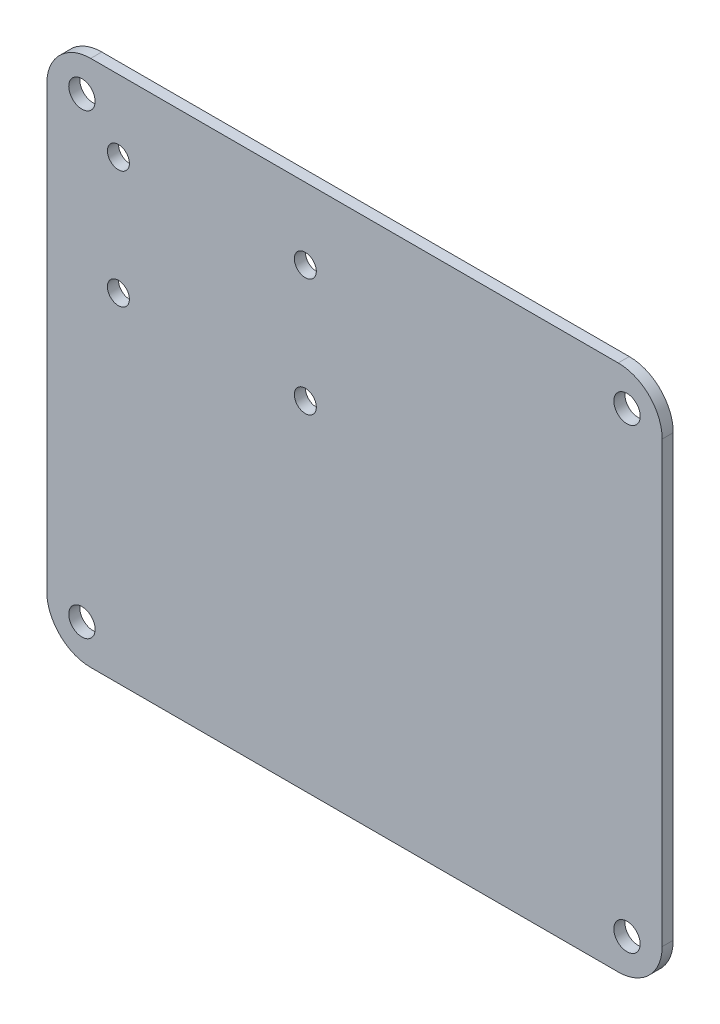
from build123d import *

# Parameters (mm, degrees)
SKETCH1_W           = 88.9
SKETCH1_H           = 76.2
BOSS_EXTRUDE1_DEPTH = 1.6
SKETCH2_R           = 1.5875
CUT_EXTRUDE1_DEPTH  = 101.188481331
SKETCH4_R           = 1.905
CUT_EXTRUDE2_DEPTH  = 101.188481331
FILLET1_R           = 6.35


with BuildPart() as part:
    # Sketch1 → Boss-Extrude1 (new body)
    with BuildSketch(Plane.XY):
        with Locations((28.959521177, 30.063142475)):
            Rectangle(SKETCH1_W, SKETCH1_H)
    extrude(amount=BOSS_EXTRUDE1_DEPTH)

    # Sketch2 → Cut-Extrude1 (cut, through all)
    with BuildSketch(Plane(origin=(0, 0, 0), x_dir=(-1, 0, 0), z_dir=(0, 0, -1))):
        with Locations((5.140478823, 57.813142475)):
            Circle(SKETCH2_R)
        with Locations((-21.859521177, 57.813142475)):
            Circle(SKETCH2_R)
        with Locations((-21.859521177, 40.813142475)):
            Circle(SKETCH2_R)
        with Locations((5.140478823, 40.813142475)):
            Circle(SKETCH2_R)
    extrude(amount=-CUT_EXTRUDE1_DEPTH, mode=Mode.SUBTRACT)

    # Sketch4 → Cut-Extrude2 (cut, through all)
    with BuildSketch(Plane(origin=(0, 0, 0), x_dir=(-1, 0, 0), z_dir=(0, 0, -1))):
        with Locations((10.410478823, 63.083142475)):
            Circle(SKETCH4_R)
        with Locations((-68.329521177, 63.083142475)):
            Circle(SKETCH4_R)
        with Locations((-68.329521177, -2.956857525)):
            Circle(SKETCH4_R)
        with Locations((10.410478823, -2.956857525)):
            Circle(SKETCH4_R)
    extrude(amount=-CUT_EXTRUDE2_DEPTH, mode=Mode.SUBTRACT)

    # Fillet1
    fillet1_edges = [part.edges().sort_by_distance(p)[0] for p in [
        (73.409521177, 68.163142475, 0.8),
        (73.409521177, -8.036857525, 0.8),
        (-15.490478823, -8.036857525, 0.8),
        (-15.490478823, 68.163142475, 0.8),
    ]]
    fillet(fillet1_edges, radius=FILLET1_R)


solid = part.part
